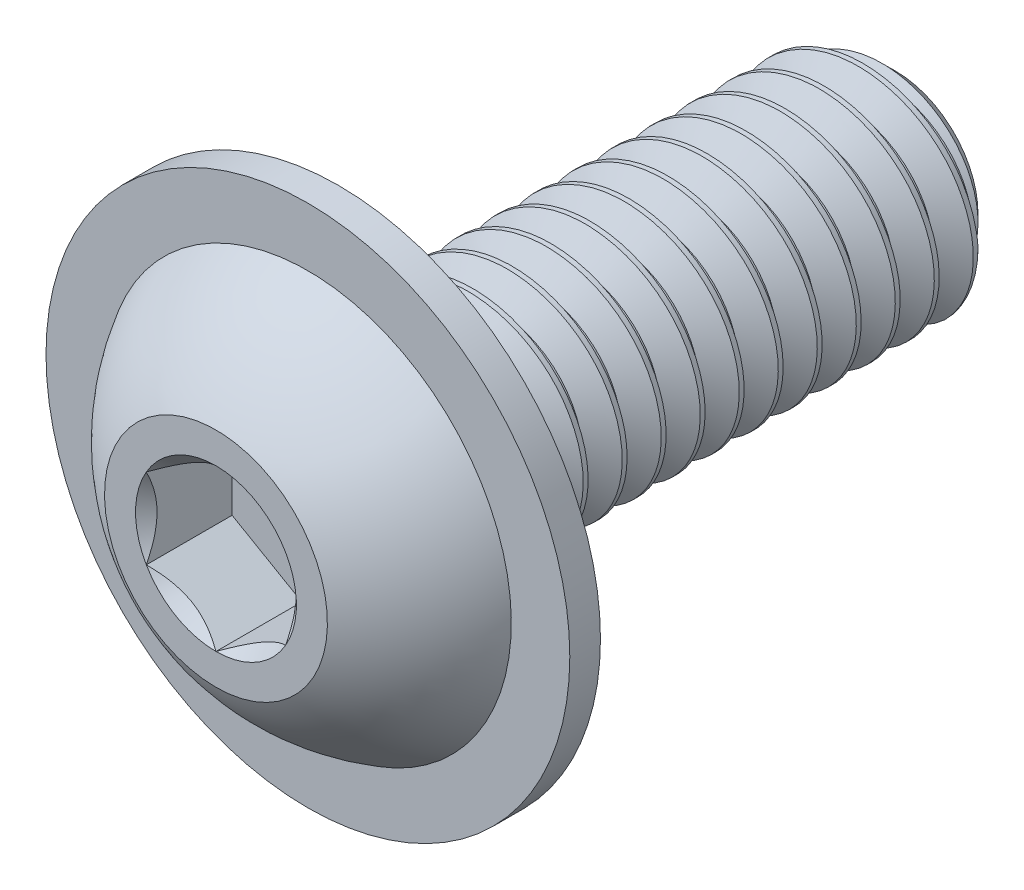
from build123d import *

# Parameters (mm, degrees)
SKETCH1_W           = 10
SKETCH1_H           = 2
CHAMFER1_SIZE       = 0.525
CUT_SWEEP1_PITCH    = 0.7
SKETCH11_R          = 4.7
BOSS_EXTRUDE3_DEPTH = 0.55
CUT_EXTRUDE2_DEPTH  = 1.54


with BuildPart() as part:
    # Sketch1 → Revolve1 (revolve)
    with BuildSketch(Plane(origin=(0, 0, 0), x_dir=(0, 0, -1), z_dir=(1, 0, 0))):
        with Locations((7.2, 1)):
            Rectangle(SKETCH1_W, SKETCH1_H)
    revolve(axis=Axis((0, 0, -12.2), (0, 0, 1)))

    # Chamfer1
    chamfer1_edges = [part.edges().sort_by_distance(p)[0] for p in [
        (0, -2, -12.2),
    ]]
    chamfer(chamfer1_edges, length=CHAMFER1_SIZE)

    # Cut-Sweep1: the profile of Sketch2 profile screwed along a right-hand helix of 15.285714 turns, 6 arcs to a turn; built about Z, then put on its axis
    cut_sweep1_z = Axis((0, 0, 0), (0, 0, 1))
    cut_sweep1_corners = [(2.0003, 0, 0.000173205), (2.0003, 0, -0.612673205), (1.545336663, 0, -0.35), (1.545336663, 0, -0.2625)]
    with BuildLine(mode=Mode.PRIVATE) as cut_sweep1_profile:
        Line(cut_sweep1_corners[0], cut_sweep1_corners[1])
        Line(cut_sweep1_corners[1], cut_sweep1_corners[2])
        Line(cut_sweep1_corners[2], cut_sweep1_corners[3])
        Line(cut_sweep1_corners[3], cut_sweep1_corners[0])
    cut_sweep1_cap = Face(cut_sweep1_profile.wire())
    cut_sweep1_turn_angles = [0, 30, 60, 90, 120, 150, 180, 210, 240, 270, 300, 330, 360]
    cut_sweep1_turn_weights = [1, 0.8660254037844387, 1, 0.8660254037844387, 1, 0.8660254037844387, 1, 0.8660254037844387, 1, 0.8660254037844387, 1, 0.8660254037844387, 1]
    cut_sweep1_turn_rails = [Edge.make_bspline([Vector(p[0], p[1], 0).rotate(cut_sweep1_z, cut_sweep1_turn_angles[k]) / cut_sweep1_turn_weights[k] + Vector(0, 0, p[2] + CUT_SWEEP1_PITCH * cut_sweep1_turn_angles[k] / 360) for k in range(13)], [0, 0, 0, 1, 1, 2, 2, 3, 3, 4, 4, 5, 5, 6, 6, 6], 2, cut_sweep1_turn_weights) for p in cut_sweep1_corners]
    cut_sweep1_turn_sides = [Face.make_surface_from_curves(cut_sweep1_turn_rails[p[0]], cut_sweep1_turn_rails[p[1]]) for p in [(0, 1), (1, 2), (2, 3), (3, 0)]]
    cut_sweep1_last_angles = [5400, 5430, 5460, 5481.428571429, 5502.857142857]
    cut_sweep1_last_weights = [1, 0.8660254037844387, 1, 0.930873748644215, 1]
    cut_sweep1_last_rails = [Edge.make_bspline([Vector(p[0], p[1], 0).rotate(cut_sweep1_z, cut_sweep1_last_angles[k]) / cut_sweep1_last_weights[k] + Vector(0, 0, p[2] + CUT_SWEEP1_PITCH * cut_sweep1_last_angles[k] / 360) for k in range(5)], [0, 0, 0, 1, 1, 2, 2, 2], 2, cut_sweep1_last_weights) for p in cut_sweep1_corners]
    cut_sweep1_last_sides = [Face.make_surface_from_curves(cut_sweep1_last_rails[p[0]], cut_sweep1_last_rails[p[1]]) for p in [(0, 1), (1, 2), (2, 3), (3, 0)]]
    cut_sweep1 = Plane(origin=(0, 0, -12.2), x_dir=(0, 1, 0), z_dir=(0, 0, 1)) * Solid(Shell([*[p.moved(Location((0, 0, CUT_SWEEP1_PITCH * i))) for i in range(15) for p in cut_sweep1_turn_sides], *cut_sweep1_last_sides, cut_sweep1_cap, cut_sweep1_cap.rotate(cut_sweep1_z, 5502.857142857).moved(Location((0, 0, CUT_SWEEP1_PITCH * 5502.857142857 / 360)))]))
    add(cut_sweep1, mode=Mode.SUBTRACT)

    # Sketch7 → Revolve2 (revolve)
    with BuildSketch(Plane(origin=(0, 0, 0), x_dir=(0, 0, -1), z_dir=(1, 0, 0)), mode=Mode.PRIVATE) as revolve2_sk:
        with BuildLine():
            Line((1.65, 3.65), (2.2, 3.65))
            Line((2.2, 3.65), (2.2, 0))
            Line((2.2, 0), (0, 0))
            Line((0, 0), (0, 2))
            ThreePointArc((0, 2), (0.70699983, 2.94300017), (1.65, 3.65))
        make_face()
    revolve(revolve2_sk.sketch.rotate(Axis((0, 0, 0), (0, 0, -1)), 189.336081704), axis=Axis((0, 0, 0), (0, 0, -1)))

    # Sketch11 → Boss-Extrude3 (add)
    with BuildSketch(Plane(origin=(0, 0, -2.2), x_dir=(-1, 0, 0), z_dir=(0, 0, -1))):
        Circle(SKETCH11_R)
    extrude(amount=-BOSS_EXTRUDE3_DEPTH)

    # Sketch5 → Cut-Extrude2 (cut)
    with BuildSketch(Plane.XY):
        Polygon((1.25, -0.721687836), (1.25, 0.721687836), (0, 1.443375673), (-1.25, 0.721687836), (-1.25, -0.721687836), (0, -1.443375673), align=None)
    extrude(amount=-CUT_EXTRUDE2_DEPTH, mode=Mode.SUBTRACT)

    # Cut-Extrude3 cone 1 section (through the dimple's axis) → Cut-Extrude3 (revolve, cut)
    with BuildSketch(Plane(origin=(0, 0, 0), x_dir=(0, -1, 0), z_dir=(1, 0, 0))):
        Polygon((0, 0), (1.443375673, 0), (0, 1.443375673), align=None)
    revolve(axis=Axis((0, 0, 0), (0, 0, -1)), mode=Mode.SUBTRACT)


solid = part.part
